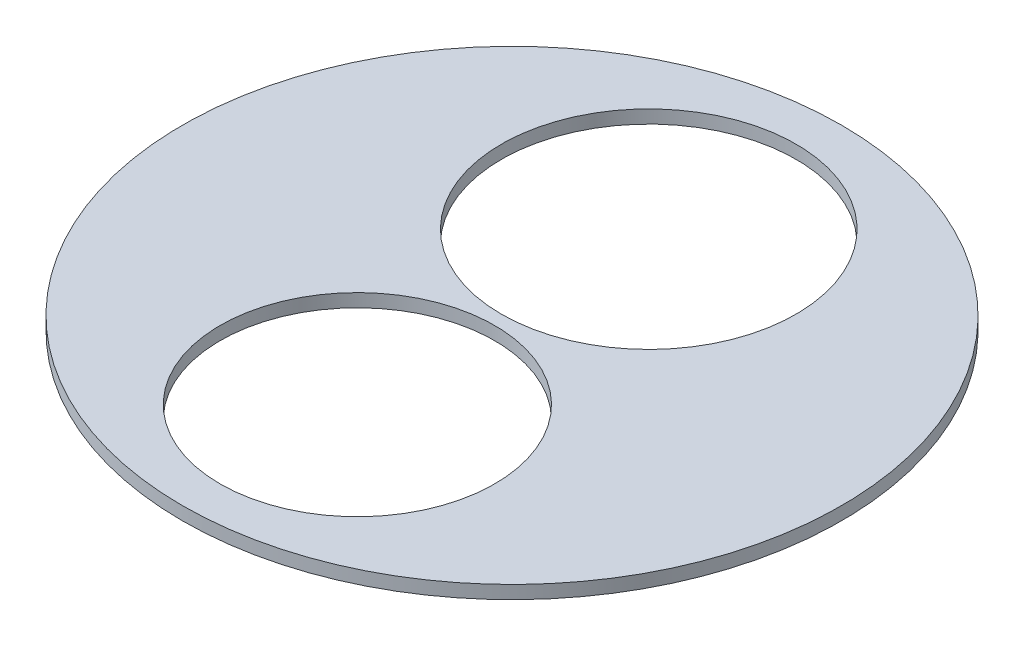
from build123d import *

# Parameters (mm, degrees)
SKETCH1_R           = 1250.00004
SKETCH1_R_2         = 558.8
SKETCH1_R_3         = 520.7
BOSS_EXTRUDE1_DEPTH = 50


with BuildPart() as part:
    # Sketch1 → Boss-Extrude1 (new body)
    with BuildSketch(Plane(origin=(0, 0, 0), x_dir=(1, 0, 0), z_dir=(0, 1, 0))):
        Circle(SKETCH1_R)
        with Locations((-23.891136443, 542.571345712)):
            Circle(SKETCH1_R_2, mode=Mode.SUBTRACT)
        with Locations((0, -586.513634847)):
            Circle(SKETCH1_R_3, mode=Mode.SUBTRACT)
    extrude(amount=BOSS_EXTRUDE1_DEPTH)


solid = part.part
